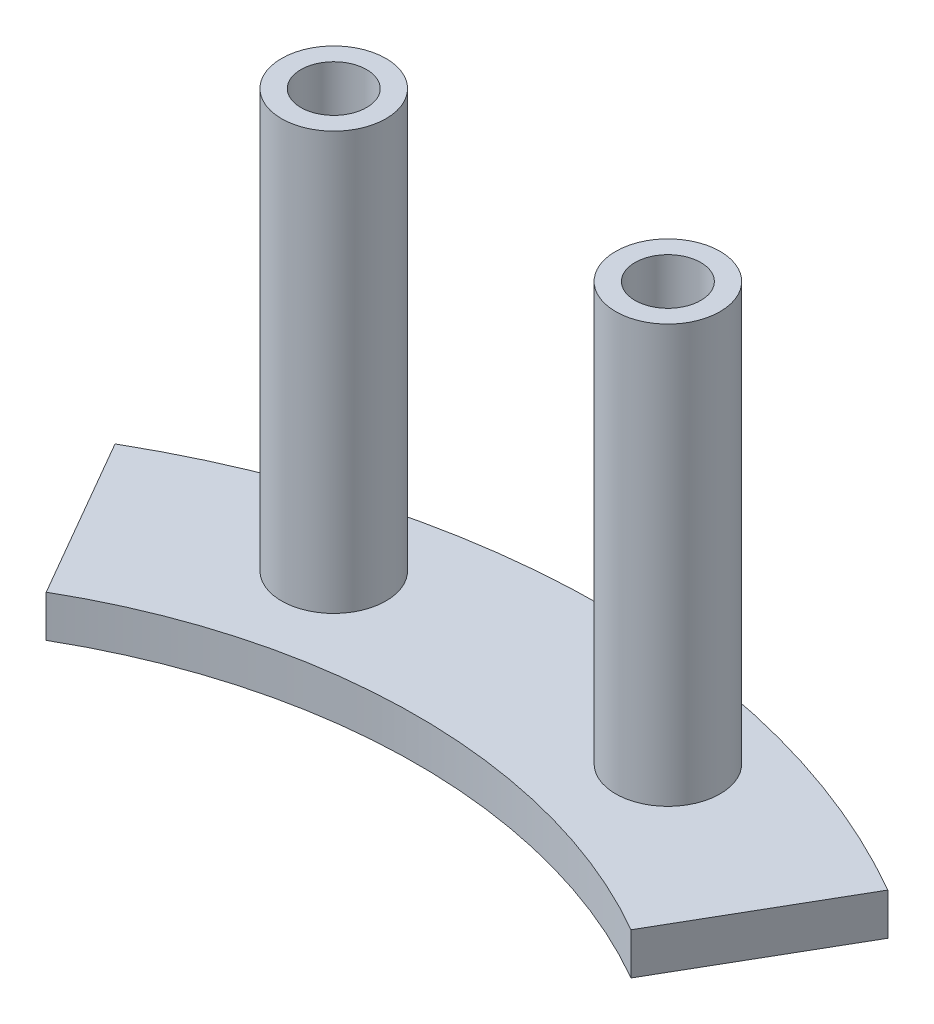
from build123d import *

# Parameters (mm, degrees)
BOSS_EXTRUDE1_DEPTH = 2
SKETCH2_R           = 2.5
BOSS_EXTRUDE2_DEPTH = 20
SKETCH5_R           = 1.575
CUT_EXTRUDE1_DEPTH  = 3.5


with BuildPart() as part:
    # Sketch1 → Boss-Extrude1 (new body)
    with BuildSketch(Plane(origin=(0, 0, 0), x_dir=(1, 0, 0), z_dir=(0, 1, 0))):
        with BuildLine():
            Line((-18.5, 32.04293994), (-14, 24.248711306))
            ThreePointArc((-14, 24.248711306), (0, 28), (14, 24.248711306))
            Line((14, 24.248711306), (18.5, 32.04293994))
            ThreePointArc((18.5, 32.04293994), (0, 37), (-18.5, 32.04293994))
        make_face()
    extrude(amount=BOSS_EXTRUDE1_DEPTH)

    # Sketch2 → Boss-Extrude2 (add)
    with BuildSketch(Plane(origin=(0, 2, 0), x_dir=(1, 0, 0), z_dir=(0, 1, 0))):
        with Locations((-8, 32.015621187)):
            Circle(SKETCH2_R)
        with Locations((8, 32.015621187)):
            Circle(SKETCH2_R)
    extrude(amount=BOSS_EXTRUDE2_DEPTH)

    # Sketch5 → Cut-Extrude1 (cut)
    with BuildSketch(Plane(origin=(0, 22, 0), x_dir=(1, 0, 0), z_dir=(0, 1, 0))):
        with Locations((-8, 32.015621187)):
            Circle(SKETCH5_R)
        with Locations((8, 32.015621187)):
            Circle(SKETCH5_R)
    extrude(amount=-CUT_EXTRUDE1_DEPTH, mode=Mode.SUBTRACT)


solid = part.part
